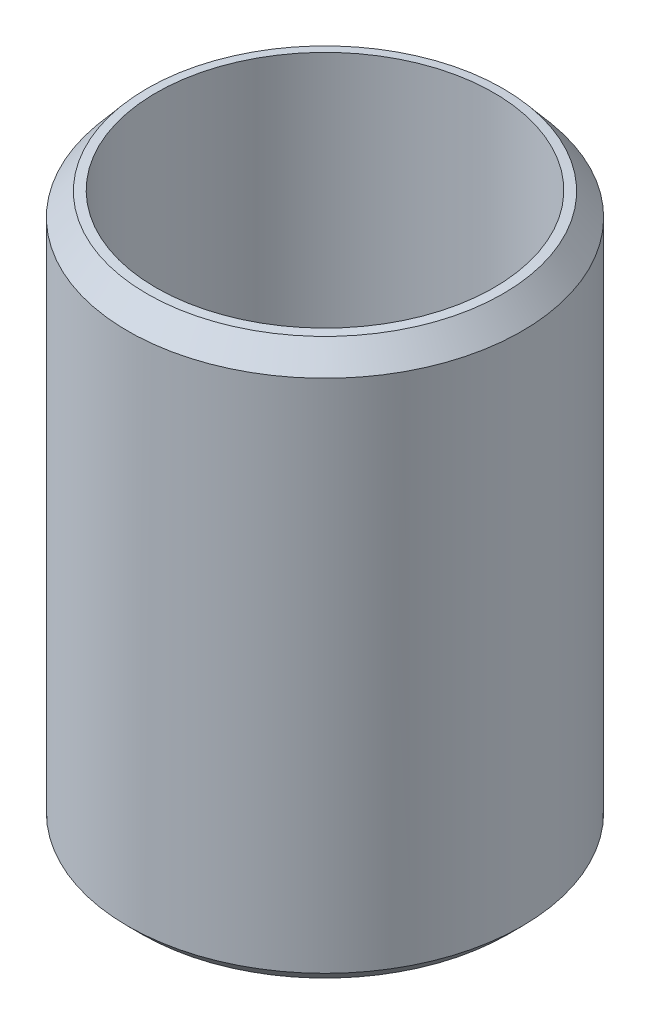
from build123d import *

# Parameters (mm, degrees)
CROQUIS2_R            = 6
CORTAR_EXTRUIR1_DEPTH = 60
CHAFL_N2_SIZE         = 0.5
CHAFL_N2_SIZE_2       = 0.354903907


with BuildPart() as part:
    # Croquis1 → Revolución1 (revolve)
    with BuildSketch(Plane.XY, mode=Mode.PRIVATE) as revoluci_n1_sk:
        Polygon((-7, 18.808246407), (-7, 0), (0, 0), (0, 20), (-6, 20), align=None)
    revolve(revoluci_n1_sk.sketch.rotate(Axis((0, 0, 0), (0, 1, 0)), 270), axis=Axis((0, 0, 0), (0, 1, 0)))

    # Croquis2 → Cortar-Extruir1 (cut)
    with BuildSketch(Plane(origin=(0, 20, 0), x_dir=(1, 0, 0), z_dir=(0, 1, 0))):
        with Locations(Location((0, 0, 0), (0, 0, 270))):
            Circle(CROQUIS2_R)
    extrude(amount=-CORTAR_EXTRUIR1_DEPTH, mode=Mode.SUBTRACT)

    # Chaflán2
    # the kernel refuses this chamfer: 0.5, 0.354903907 mm, written as the material it takes off along each edge
    with BuildSketch(Plane(origin=(0, 0, 0), x_dir=(0, 0, 1), z_dir=(-1, 0, 0))) as chafl_n2_piece_1:
        Polygon((6 + CHAFL_N2_SIZE, 0), (6, CHAFL_N2_SIZE), (6, 0), align=None)
    revolve(axis=Axis((0, 0, 0), (0, 1, 0)), mode=Mode.SUBTRACT)
    with BuildSketch(Plane(origin=(0, 0, 0), x_dir=(0, 0, -1), z_dir=(1, 0, 0))) as chafl_n2_piece_2:
        Polygon((7, CHAFL_N2_SIZE), (7 - CHAFL_N2_SIZE, 0), (7, 0), align=None)
    revolve(axis=Axis((0, 0, 0), (0, 1, 0)), mode=Mode.SUBTRACT)
    with BuildSketch(Plane(origin=(0, 20, 0), x_dir=(0, 0, 1), z_dir=(-1, 0, 0))) as chafl_n2_piece_3:
        Polygon((6 + CHAFL_N2_SIZE * 0.642787609687, -CHAFL_N2_SIZE * 0.766044443119), (6, -CHAFL_N2_SIZE_2), (6, 0), align=None)
    revolve(axis=Axis((0, 20, 0), (0, 1, 0)), revolution_arc=180, mode=Mode.SUBTRACT)
    with BuildSketch(Plane(origin=(0, 20, 0), x_dir=(0, 0, -1), z_dir=(1, 0, 0))) as chafl_n2_piece_4:
        Polygon((6 + CHAFL_N2_SIZE * 0.642787609687, -CHAFL_N2_SIZE * 0.766044443119), (6, -CHAFL_N2_SIZE_2), (6, 0), align=None)
    revolve(axis=Axis((0, 20, 0), (0, 1, 0)), revolution_arc=180, mode=Mode.SUBTRACT)


solid = part.part
